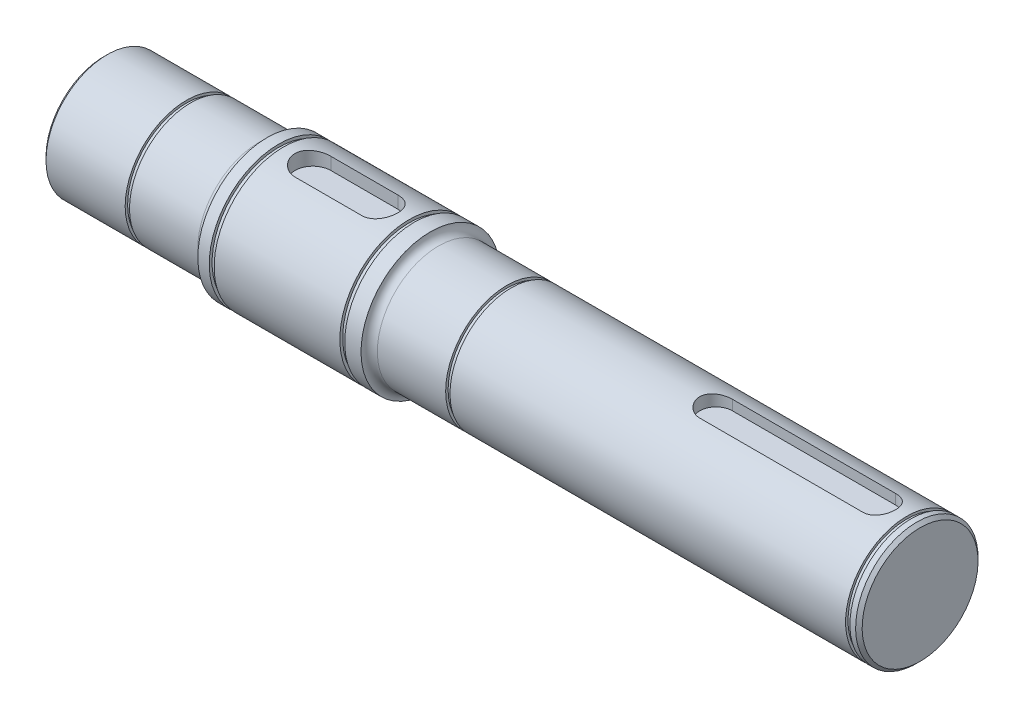
from build123d import *

# Parameters (mm, degrees)
ESQUISSE2_R             = 42.5
ESQUISSE2_R_2           = 40.75
ENL_V_MAT_EXTRU_1_DEPTH = 3
ESQUISSE3_R             = 42.5
ESQUISSE3_R_2           = 40.75
ENL_V_MAT_EXTRU_2_DEPTH = 3
ENL_V_MAT_EXTRU_3_DEPTH = 9
ENL_V_MAT_EXTRU_4_DEPTH = 7.5
CHANFREIN1_SIZE         = 2
ESQUISSE6_R             = 37.5
ESQUISSE6_R_2           = 36
ENL_V_MAT_EXTRU_5_DEPTH = 2.65
ENL_V_START             = -2.65
ESQUISSE7_R             = 37.5
ESQUISSE7_R_2           = 36
ENL_V_MAT_EXTRU_6_DEPTH = 2.65
ESQUISSE8_R             = 37.5
ESQUISSE8_R_2           = 36
ENL_V_MAT_EXTRU_7_DEPTH = 2.65


with BuildPart() as part:
    # Esquisse1 → Révolution1 (revolve)
    with BuildSketch(Plane.XY):
        with BuildLine():
            Line((0, 0), (0, 37.5))
            Line((0, 37.5), (95, 37.5))
            ThreePointArc((95, 37.5), (98.535533906, 38.964466094), (100, 42.5))
            Line((100, 42.5), (200, 42.5))
            ThreePointArc((200, 42.5), (201.464466094, 38.964466094), (205, 37.5))
            Line((205, 37.5), (500, 37.5))
            Line((500, 37.5), (500, 0))
            Line((500, 0), (0, 0))
        make_face()
    revolve(axis=Axis((500, 0, 0), (-1, 0, 0)))

    # Esquisse2 → Enlèv. mat.-Extru.1 (cut)
    with BuildSketch(Plane(origin=(110, 0, 0), x_dir=(0, 0, -1), z_dir=(1, 0, 0))):
        Circle(ESQUISSE2_R)
        Circle(ESQUISSE2_R_2, mode=Mode.SUBTRACT)
    extrude(amount=-ENL_V_MAT_EXTRU_1_DEPTH, mode=Mode.SUBTRACT)

    # Esquisse3 → Enlèv. mat.-Extru.2 (cut)
    with BuildSketch(Plane(origin=(190, 0, 0), x_dir=(0, 0, -1), z_dir=(1, 0, 0))):
        Circle(ESQUISSE3_R)
        Circle(ESQUISSE3_R_2, mode=Mode.SUBTRACT)
    extrude(amount=-ENL_V_MAT_EXTRU_2_DEPTH, mode=Mode.SUBTRACT)

    # Esquisse4 → Enlèv. mat.-Extru.3 (cut)
    with BuildSketch(Plane(origin=(0, 42.5, 0), x_dir=(1, 0, 0), z_dir=(0, 1, 0))):
        with BuildLine():
            Line((128, 11), (169, 11))
            ThreePointArc((169, 11), (180, 0), (169, -11))
            Line((169, -11), (128, -11))
            ThreePointArc((128, -11), (117, 0), (128, 11))
        make_face()
    extrude(amount=-ENL_V_MAT_EXTRU_3_DEPTH, mode=Mode.SUBTRACT)

    # Esquisse5 → Enlèv. mat.-Extru.4 (cut)
    with BuildSketch(Plane(origin=(0, 37.5, 0), x_dir=(1, 0, 0), z_dir=(0, 1, 0))):
        with BuildLine():
            Line((475, -10), (375, -10))
            ThreePointArc((375, -10), (365, 0), (375, 10))
            Line((375, 10), (475, 10))
            ThreePointArc((475, 10), (485, 0), (475, -10))
        make_face()
    extrude(amount=-ENL_V_MAT_EXTRU_4_DEPTH, mode=Mode.SUBTRACT)

    # Chanfrein1
    chanfrein1_edges = [part.edges().sort_by_distance(p)[0] for p in [
        (500, -37.5, 0),
        (0, -37.5, 0),
    ]]
    chamfer(chanfrein1_edges, length=CHANFREIN1_SIZE)

    # Esquisse6 → Enlèv. mat.-Extru.5 (cut)
    with BuildSketch(Plane(origin=(494.5, 0, 0), x_dir=(0, 0, -1), z_dir=(1, 0, 0))):
        Circle(ESQUISSE6_R)
        Circle(ESQUISSE6_R_2, mode=Mode.SUBTRACT)
    extrude(amount=-ENL_V_MAT_EXTRU_5_DEPTH, mode=Mode.SUBTRACT)

    # Esquisse7 → Enlèv. mat.-Extru.6 (cut)
    with BuildSketch(Plane.ZY.offset(-50.5).offset(ENL_V_START)):
        Circle(ESQUISSE7_R)
        Circle(ESQUISSE7_R_2, mode=Mode.SUBTRACT)
    extrude(amount=ENL_V_MAT_EXTRU_6_DEPTH, mode=Mode.SUBTRACT)

    # Esquisse8 → Enlèv. mat.-Extru.7 (cut)
    with BuildSketch(Plane.ZY.offset(-249.5)):
        Circle(ESQUISSE8_R)
        Circle(ESQUISSE8_R_2, mode=Mode.SUBTRACT)
    extrude(amount=ENL_V_MAT_EXTRU_7_DEPTH, mode=Mode.SUBTRACT)


solid = part.part
